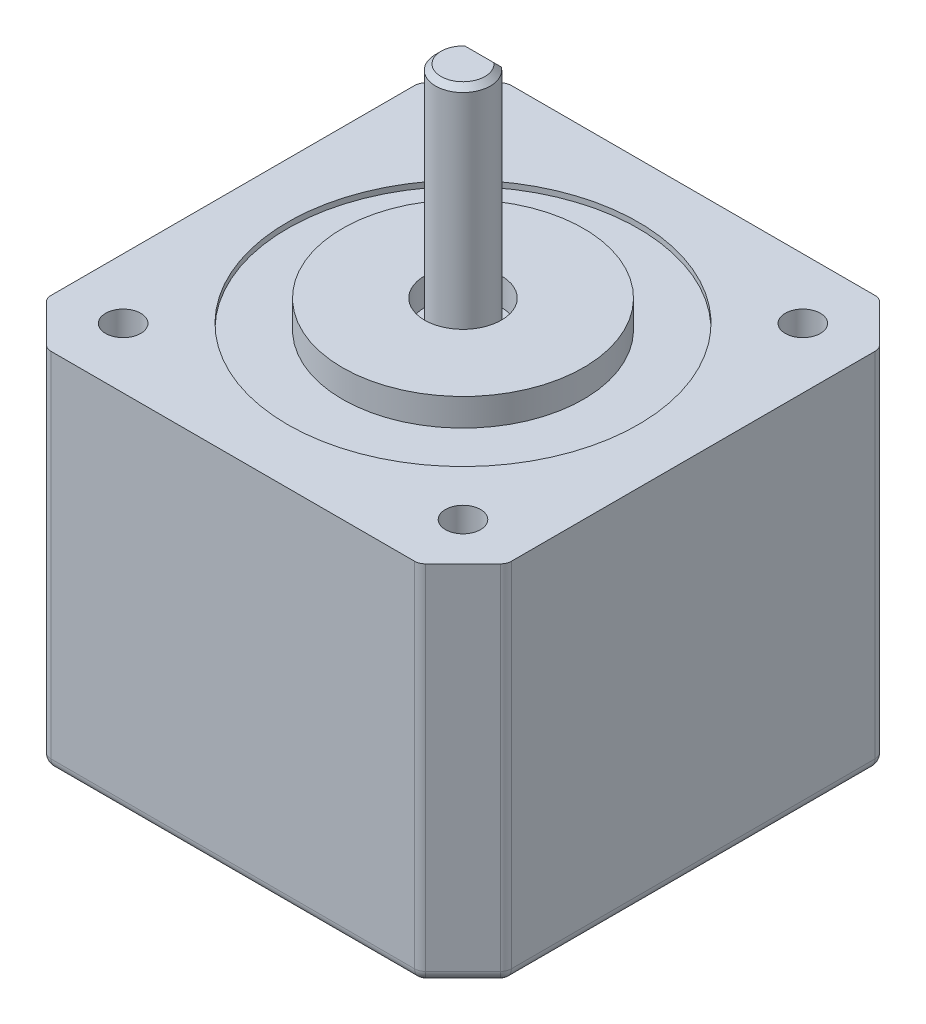
from build123d import *

# Parameters (mm, degrees)
SKETCH1_W           = 42
SKETCH1_H           = 42
BOSS_EXTRUDE1_DEPTH = 33.2
CHAMFER1_SIZE       = 4
SKETCH2_R           = 16
CUT_EXTRUDE1_DEPTH  = 0.5
SKETCH3_R           = 11
BOSS_EXTRUDE3_DEPTH = 2.5
SKETCH4_R           = 3.5
CUT_EXTRUDE2_DEPTH  = 2.5
SKETCH7_R           = 5.5
CUT_EXTRUDE4_DEPTH  = 4
SKETCH5_R           = 2.5
BOSS_EXTRUDE4_DEPTH = 21
CUT_EXTRUDE3_START  = -16
CUT_EXTRUDE3_DEPTH  = 16
CHAMFER2_SIZE       = 0.5
SKETCH8_R           = 1.6
CUT_EXTRUDE5_DEPTH  = 6
SKETCH9_W           = 8
SKETCH9_H           = 7
CUT_EXTRUDE6_DEPTH  = 4
FILLET1_R           = 1


with BuildPart() as part:
    # Sketch1 → Boss-Extrude1 (new body)
    with BuildSketch(Plane(origin=(0, 0, 0), x_dir=(1, 0, 0), z_dir=(0, 1, 0))):
        with Locations((21, 21)):
            Rectangle(SKETCH1_W, SKETCH1_H)
    extrude(amount=BOSS_EXTRUDE1_DEPTH)

    # Chamfer1
    chamfer1_edges = [part.edges().sort_by_distance(p)[0] for p in [
        (0, 16.6, -42),
        (42, 16.6, -42),
        (42, 16.6, 0),
        (0, 16.6, 0),
    ]]
    chamfer(chamfer1_edges, length=CHAMFER1_SIZE)

    # Sketch2 → Cut-Extrude1 (cut)
    with BuildSketch(Plane(origin=(0, 33.2, 0), x_dir=(1, 0, 0), z_dir=(0, 1, 0))):
        with Locations(Location((21, 21, 0), (0, 0, 270))):
            Circle(SKETCH2_R)
    extrude(amount=-CUT_EXTRUDE1_DEPTH, mode=Mode.SUBTRACT)

    # Sketch3 → Boss-Extrude3 (add)
    with BuildSketch(Plane(origin=(0, 32.7, 0), x_dir=(1, 0, 0), z_dir=(0, 1, 0))):
        with Locations(Location((21, 21, 0), (0, 0, 270))):
            Circle(SKETCH3_R)
    extrude(amount=BOSS_EXTRUDE3_DEPTH)

    # Sketch4 → Cut-Extrude2 (cut)
    with BuildSketch(Plane(origin=(0, 35.2, 0), x_dir=(1, 0, 0), z_dir=(0, 1, 0))):
        with Locations(Location((21, 21, 0), (0, 0, 270))):
            Circle(SKETCH4_R)
    extrude(amount=-CUT_EXTRUDE2_DEPTH, mode=Mode.SUBTRACT)

    # Sketch7 → Cut-Extrude4 (cut)
    with BuildSketch(Plane.XZ):
        with Locations(Location((21, -21.16858083, 0), (0, 0, 270))):
            Circle(SKETCH7_R)
    extrude(amount=-CUT_EXTRUDE4_DEPTH, mode=Mode.SUBTRACT)

    # Sketch5 → Boss-Extrude4 (add)
    with BuildSketch(Plane(origin=(0, 32.7, 0), x_dir=(1, 0, 0), z_dir=(0, 1, 0))):
        with Locations(Location((21, 21, 0), (0, 0, 90))):
            Circle(SKETCH5_R)
    extrude(amount=BOSS_EXTRUDE4_DEPTH)

    # Sketch6 → Cut-Extrude3 (cut)
    with BuildSketch(Plane(origin=(0, 53.7, 0), x_dir=(1, 0, 0), z_dir=(0, 1, 0)).offset(CUT_EXTRUDE3_START)):
        with BuildLine():
            Line((19.5, 23), (22.5, 23))
            ThreePointArc((22.5, 23), (21, 23.5), (19.5, 23))
        make_face()
    extrude(amount=CUT_EXTRUDE3_DEPTH, mode=Mode.SUBTRACT)

    # Chamfer2
    chamfer2_edges = [part.edges().sort_by_distance(p)[0] for p in [
        (21, 53.7, -18.5),
        (21, 53.7, -23),
    ]]
    chamfer(chamfer2_edges, length=CHAMFER2_SIZE - 0.0001)  # a hair under: the kernel refuses the full size

    # Sketch8 → Cut-Extrude5 (cut)
    with BuildSketch(Plane(origin=(0, 33.2, 0), x_dir=(1, 0, 0), z_dir=(0, 1, 0))):
        with Locations(Location((5.5, 36.5, 0), (0, 0, 270))):
            Circle(SKETCH8_R)
        with Locations(Location((36.5, 36.5, 0), (0, 0, 270))):
            Circle(SKETCH8_R)
        with Locations(Location((36.5, 5.5, 0), (0, 0, 270))):
            Circle(SKETCH8_R)
        with Locations(Location((5.5, 5.5, 0), (0, 0, 270))):
            Circle(SKETCH8_R)
    extrude(amount=-CUT_EXTRUDE5_DEPTH, mode=Mode.SUBTRACT)

    # Sketch9 → Cut-Extrude6 (cut)
    with BuildSketch(Plane(origin=(0, 0, -42), x_dir=(-1, 0, 0), z_dir=(0, 0, -1))):
        with Locations((-21, 5.8)):
            Rectangle(SKETCH9_W, SKETCH9_H)
    extrude(amount=-CUT_EXTRUDE6_DEPTH, mode=Mode.SUBTRACT)

    # Fillet1
    fillet1_edges = [part.edges().sort_by_distance(p)[0] for p in [
        (0, 0, -21),
        (0, 16.6, -4),
        (0, 16.6, -38),
        (21, 0, -42),
        (42, 0, -21),
        (21, 0, 0),
        (40, 0, -2),
        (2, 0, -2),
        (40, 0, -40),
        (2, 0, -40),
        (38, 16.6, -42),
        (4, 16.6, -42),
        (42, 16.6, -4),
        (42, 16.6, -38),
        (38, 16.6, 0),
        (4, 16.6, 0),
        (21, 0, -15.66858083),
    ]]
    fillet(fillet1_edges, radius=FILLET1_R)


solid = part.part
